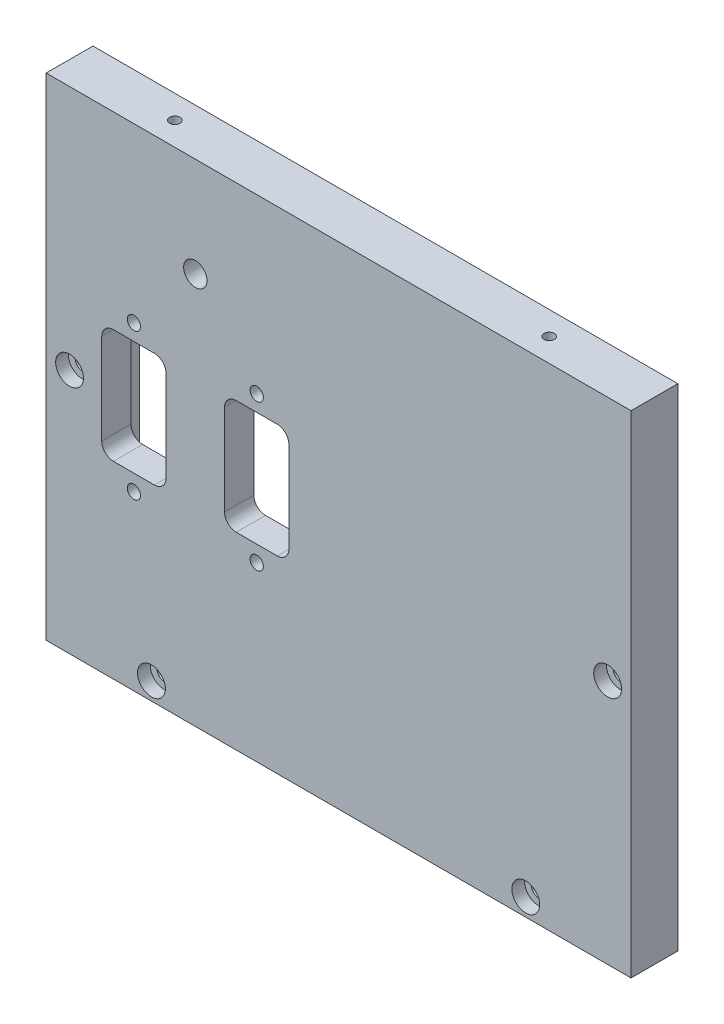
from build123d import *

# Parameters (mm, degrees)
SKETCH1_W                                      = 100
SKETCH1_H                                      = 84
BOSS_EXTRUDE1_DEPTH                            = 8
CBORE_FOR_2_SOCKET_HEAD_CAP_SCREW1_D           = 2.4384
CBORE_FOR_2_SOCKET_HEAD_CAP_SCREW1_DEPTH       = 12.27
CBORE_FOR_2_SOCKET_HEAD_CAP_SCREW1_CBORE_D     = 4.7625
CBORE_FOR_2_SOCKET_HEAD_CAP_SCREW1_CBORE_DEPTH = 2.1844
CBORE_FOR_2_SOCKET_HEAD_CAP_SCREW1_TIP         = 0.732569267
CBORE_FOR_2_SOCKET_HEAD_CAP_SCREW2_D           = 2.4384
CBORE_FOR_2_SOCKET_HEAD_CAP_SCREW2_DEPTH       = 12.27
CBORE_FOR_2_SOCKET_HEAD_CAP_SCREW2_CBORE_D     = 4.7625
CBORE_FOR_2_SOCKET_HEAD_CAP_SCREW2_CBORE_DEPTH = 2.1844
CBORE_FOR_2_SOCKET_HEAD_CAP_SCREW2_TIP         = 0.732569267
F_2_56_TAPPED_HOLE1_D                          = 1.778
F_2_56_TAPPED_HOLE1_DEPTH                      = 12
F_2_56_TAPPED_HOLE1_TIP                        = 0.53416509
SKETCH12_W                                     = 35
SKETCH12_H                                     = 60
CUT_EXTRUDE3_DEPTH                             = 3
FILLET1_R                                      = 2
FILLET2_R                                      = 2
FILLET3_R                                      = 2
FILLET4_R                                      = 2
SKETCH17_W                                     = 11
SKETCH17_H                                     = 19.5
CUT_EXTRUDE4_DEPTH                             = 8
SKETCH16_W                                     = 11
SKETCH16_H                                     = 19.5
CUT_EXTRUDE5_DEPTH                             = 8
FILLET5_R                                      = 2
FILLET6_R                                      = 2
FILLET7_R                                      = 2
FILLET8_R                                      = 2
F_4_40_TAPPED_HOLE1_D                          = 2.2606
SKETCH21_R                                     = 2
CUT_EXTRUDE6_DEPTH                             = 8


with BuildPart() as part:
    # Sketch1 → Boss-Extrude1 (new body)
    with BuildSketch(Plane.XY):
        Rectangle(SKETCH1_W, SKETCH1_H)
    extrude(amount=BOSS_EXTRUDE1_DEPTH)

    # CBORE for #2 Socket Head Cap Screw1
    with Locations(Plane(origin=(-32, -39, 8), x_dir=(1, 0, 0), z_dir=(0, 0, 1))):
        with Locations((0, 0), (64, 0)):
            CounterBoreHole(CBORE_FOR_2_SOCKET_HEAD_CAP_SCREW1_D / 2, CBORE_FOR_2_SOCKET_HEAD_CAP_SCREW1_CBORE_D / 2, CBORE_FOR_2_SOCKET_HEAD_CAP_SCREW1_CBORE_DEPTH, depth=CBORE_FOR_2_SOCKET_HEAD_CAP_SCREW1_DEPTH)
            with Locations((0, 0, -(CBORE_FOR_2_SOCKET_HEAD_CAP_SCREW1_DEPTH + CBORE_FOR_2_SOCKET_HEAD_CAP_SCREW1_TIP / 2))):  # 118° drill point
                Cone(0, CBORE_FOR_2_SOCKET_HEAD_CAP_SCREW1_D / 2, CBORE_FOR_2_SOCKET_HEAD_CAP_SCREW1_TIP, mode=Mode.SUBTRACT)

    # CBORE for #2 Socket Head Cap Screw2
    with Locations(Plane(origin=(-46, 0, 8), x_dir=(1, 0, 0), z_dir=(0, 0, 1))):
        with Locations((0, 0), (92, 0)):
            CounterBoreHole(CBORE_FOR_2_SOCKET_HEAD_CAP_SCREW2_D / 2, CBORE_FOR_2_SOCKET_HEAD_CAP_SCREW2_CBORE_D / 2, CBORE_FOR_2_SOCKET_HEAD_CAP_SCREW2_CBORE_DEPTH, depth=CBORE_FOR_2_SOCKET_HEAD_CAP_SCREW2_DEPTH)
            with Locations((0, 0, -(CBORE_FOR_2_SOCKET_HEAD_CAP_SCREW2_DEPTH + CBORE_FOR_2_SOCKET_HEAD_CAP_SCREW2_TIP / 2))):  # 118° drill point
                Cone(0, CBORE_FOR_2_SOCKET_HEAD_CAP_SCREW2_D / 2, CBORE_FOR_2_SOCKET_HEAD_CAP_SCREW2_TIP, mode=Mode.SUBTRACT)

    # #2-56 Tapped Hole1
    with Locations(Plane(origin=(-32, 42, 4), x_dir=(0, 0, 1), z_dir=(0, 1, 0))):
        with Locations((0, 0), (0, 64)):
            Hole(F_2_56_TAPPED_HOLE1_D / 2, depth=F_2_56_TAPPED_HOLE1_DEPTH)
            with Locations((0, 0, -(F_2_56_TAPPED_HOLE1_DEPTH + F_2_56_TAPPED_HOLE1_TIP / 2))):  # 118° drill point
                Cone(0, F_2_56_TAPPED_HOLE1_D / 2, F_2_56_TAPPED_HOLE1_TIP, mode=Mode.SUBTRACT)

    # Sketch12 → Cut-Extrude3 (cut)
    with BuildSketch(Plane(origin=(0, 0, 0), x_dir=(-1, 0, 0), z_dir=(0, 0, -1))):
        with Locations((24.5, 0)):
            Rectangle(SKETCH12_W, SKETCH12_H)
    extrude(amount=-CUT_EXTRUDE3_DEPTH, mode=Mode.SUBTRACT)

    # Fillet1
    fillet1_edges = [part.edges().sort_by_distance(p)[0] for p in [
        (-7, 30, 1.5),
    ]]
    fillet(fillet1_edges, radius=FILLET1_R)

    # Fillet2
    fillet2_edges = [part.edges().sort_by_distance(p)[0] for p in [
        (-42, 30, 1.5),
    ]]
    fillet(fillet2_edges, radius=FILLET2_R)

    # Fillet3
    fillet3_edges = [part.edges().sort_by_distance(p)[0] for p in [
        (-42, -30, 1.5),
    ]]
    fillet(fillet3_edges, radius=FILLET3_R)

    # Fillet4
    fillet4_edges = [part.edges().sort_by_distance(p)[0] for p in [
        (-7, -30, 1.5),
    ]]
    fillet(fillet4_edges, radius=FILLET4_R)

    # Sketch17 → Cut-Extrude4 (cut)
    with BuildSketch(Plane(origin=(0, 0, 3), x_dir=(-1, 0, 0), z_dir=(0, 0, -1))):
        with Locations((35, 0)):
            Rectangle(SKETCH17_W, SKETCH17_H)
    extrude(amount=-CUT_EXTRUDE4_DEPTH, mode=Mode.SUBTRACT)

    # Sketch16 → Cut-Extrude5 (cut)
    with BuildSketch(Plane(origin=(0, 0, 3), x_dir=(-1, 0, 0), z_dir=(0, 0, -1))):
        with Locations((14, 0)):
            Rectangle(SKETCH16_W, SKETCH16_H)
    extrude(amount=-CUT_EXTRUDE5_DEPTH, mode=Mode.SUBTRACT)

    # Fillet5
    fillet5_edges = [part.edges().sort_by_distance(p)[0] for p in [
        (-40.5, 9.75, 5.5),
        (-19.5, 9.75, 5.5),
    ]]
    fillet(fillet5_edges, radius=FILLET5_R)

    # Fillet6
    fillet6_edges = [part.edges().sort_by_distance(p)[0] for p in [
        (-29.5, 9.75, 5.5),
        (-8.5, 9.75, 5.5),
    ]]
    fillet(fillet6_edges, radius=FILLET6_R)

    # Fillet7
    fillet7_edges = [part.edges().sort_by_distance(p)[0] for p in [
        (-29.5, -9.75, 5.5),
        (-8.5, -9.75, 5.5),
    ]]
    fillet(fillet7_edges, radius=FILLET7_R)

    # Fillet8
    fillet8_edges = [part.edges().sort_by_distance(p)[0] for p in [
        (-40.5, -9.75, 5.5),
        (-19.5, -9.75, 5.5),
    ]]
    fillet(fillet8_edges, radius=FILLET8_R)

    # #4-40 Tapped Hole1 (through all)
    with Locations(Plane(origin=(-35, 12.5, 8), x_dir=(1, 0, 0), z_dir=(0, 0, 1))):
        with Locations((0, 0), (0, -25), (21, -25), (21, 0)):
            Hole(F_4_40_TAPPED_HOLE1_D / 2)

    # Sketch21 → Cut-Extrude6 (cut)
    with BuildSketch(Plane(origin=(0, 0, 3), x_dir=(-1, 0, 0), z_dir=(0, 0, -1))):
        with Locations((24.5, 25)):
            Circle(SKETCH21_R)
    extrude(amount=-CUT_EXTRUDE6_DEPTH, mode=Mode.SUBTRACT)


solid = part.part
